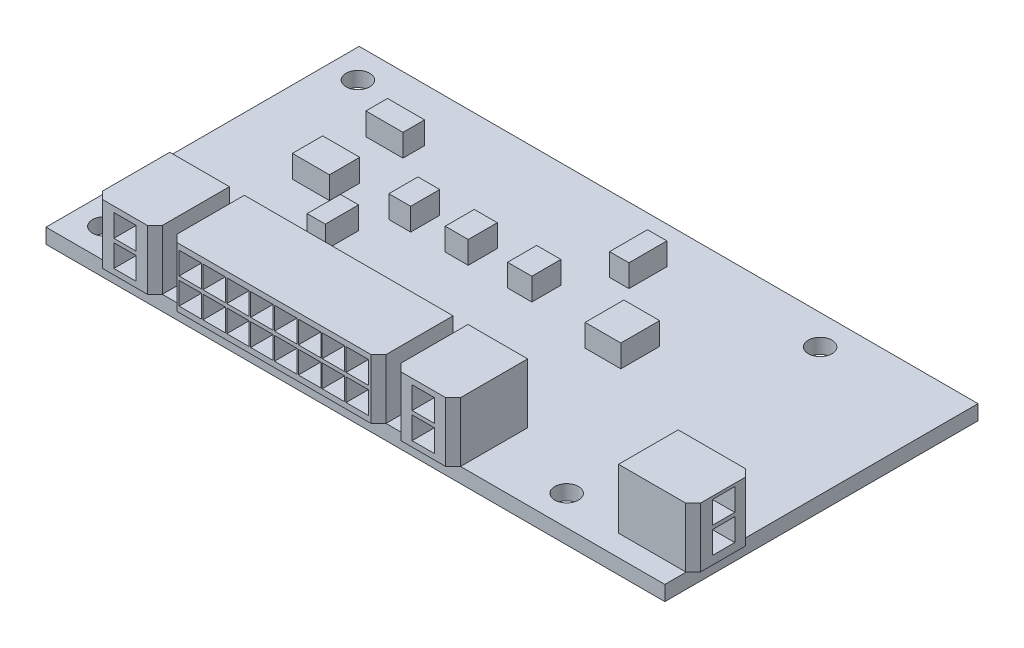
from build123d import *

# Parameters (mm, degrees)
SKETCH1_W           = 83
SKETCH1_H           = 42
BOSS_EXTRUDE1_DEPTH = 2
SKETCH4_R           = 1.5875
CUT_EXTRUDE2_DEPTH  = 94.043000811
BOSS_EXTRUDE2_DEPTH = 8
SKETCH6_W           = 3
SKETCH6_H           = 3
CUT_EXTRUDE3_DEPTH  = 9
SKETCH10_W          = 4.972668361
SKETCH10_H          = 2.900723211
SKETCH10_H_2        = 4.06167287
SKETCH10_W_2        = 4.792773987
SKETCH10_H_3        = 5.198941274
SKETCH10_W_3        = 2.924404467
SKETCH10_H_4        = 3.899205956
SKETCH10_W_4        = 3.086871382
SKETCH10_W_5        = 3.249338296
SKETCH10_W_6        = 2.437003722
SKETCH10_H_5        = 4.467840158
SKETCH10_W_7        = 2.599470637
SKETCH10_H_6        = 5.088357614
BOSS_EXTRUDE6_DEPTH = 3
SKETCH11_W          = 3
SKETCH11_H          = 3
CUT_EXTRUDE4_DEPTH  = 8


with BuildPart() as part:
    # Sketch1 → Boss-Extrude1 (new body)
    with BuildSketch(Plane(origin=(0, 0, 0), x_dir=(1, 0, 0), z_dir=(0, 1, 0))):
        with Locations((41.5, 21)):
            Rectangle(SKETCH1_W, SKETCH1_H)
    extrude(amount=BOSS_EXTRUDE1_DEPTH)

    # Sketch4 → Cut-Extrude2 (cut, through all)
    with BuildSketch(Plane(origin=(0, 2, 0), x_dir=(1, 0, 0), z_dir=(0, 1, 0))):
        with Locations((3.8264, 38)):
            Circle(SKETCH4_R)
        with Locations((65.8264, 4)):
            Circle(SKETCH4_R)
        with Locations((3.8264, 4)):
            Circle(SKETCH4_R)
        with Locations((65.8264, 38)):
            Circle(SKETCH4_R)
    extrude(amount=-CUT_EXTRUDE2_DEPTH, mode=Mode.SUBTRACT)

    # Sketch5 → Boss-Extrude2 (add)
    with BuildSketch(Plane(origin=(0, 2, 0), x_dir=(1, 0, 0), z_dir=(0, 1, 0))):
        Polygon((17.6, 9), (45.6, 9), (45.6, 0), (44.6, -1), (18.6, -1), (17.6, 0), align=None)
        Polygon((7.6, 9), (15.6, 9), (15.6, 0), (14.6, -1), (8.6, -1), (7.6, 0), align=None)
        Polygon((47.6, 9), (55.6, 9), (55.6, 0), (54.6, -1), (48.6, -1), (47.6, 0), align=None)
        Polygon((73.941121903, 2.849151782), (73.941121903, 10.849151782), (82.941121903, 10.849151782), (83.941121903, 9.849151782), (83.941121903, 3.849151782), (82.941121903, 2.849151782), align=None)
    extrude(amount=BOSS_EXTRUDE2_DEPTH)

    # Sketch6 → Cut-Extrude3 (cut)
    with BuildSketch(Plane.XY.offset(1)):
        with Locations((20.35, 4.25)):
            Rectangle(SKETCH6_W, SKETCH6_H)
        with Locations((11.6, 7.75)):
            Rectangle(SKETCH6_W, SKETCH6_H)
        with Locations((23.55, 4.25)):
            Rectangle(SKETCH6_W, SKETCH6_H)
        with Locations((11.6, 4.25)):
            Rectangle(SKETCH6_W, SKETCH6_H)
        with Locations((20.35, 7.75)):
            Rectangle(SKETCH6_W, SKETCH6_H)
        with Locations((51.6, 7.75)):
            Rectangle(SKETCH6_W, SKETCH6_H)
        with Locations((23.55, 7.75)):
            Rectangle(SKETCH6_W, SKETCH6_H)
        with Locations((26.75, 4.25)):
            Rectangle(SKETCH6_W, SKETCH6_H)
        with Locations((26.75, 7.75)):
            Rectangle(SKETCH6_W, SKETCH6_H)
        with Locations((29.95, 4.25)):
            Rectangle(SKETCH6_W, SKETCH6_H)
        with Locations((29.95, 7.75)):
            Rectangle(SKETCH6_W, SKETCH6_H)
        with Locations((33.15, 4.25)):
            Rectangle(SKETCH6_W, SKETCH6_H)
        with Locations((33.15, 7.75)):
            Rectangle(SKETCH6_W, SKETCH6_H)
        with Locations((36.35, 4.25)):
            Rectangle(SKETCH6_W, SKETCH6_H)
        with Locations((36.35, 7.75)):
            Rectangle(SKETCH6_W, SKETCH6_H)
        with Locations((39.55, 4.25)):
            Rectangle(SKETCH6_W, SKETCH6_H)
        with Locations((39.55, 7.75)):
            Rectangle(SKETCH6_W, SKETCH6_H)
        with Locations((42.75, 4.25)):
            Rectangle(SKETCH6_W, SKETCH6_H)
        with Locations((42.75, 7.75)):
            Rectangle(SKETCH6_W, SKETCH6_H)
        with Locations((51.6, 4.25)):
            Rectangle(SKETCH6_W, SKETCH6_H)
    extrude(amount=-CUT_EXTRUDE3_DEPTH, mode=Mode.SUBTRACT)

    # Sketch10 → Boss-Extrude6 (add)
    with BuildSketch(Plane(origin=(0, 2, 0), x_dir=(1, 0, 0), z_dir=(0, 1, 0))):
        with Locations((13.43956041, 33.400988797)):
            Rectangle(SKETCH10_W, SKETCH10_H)
        with Locations((13.43956041, 24.122865076)):
            Rectangle(SKETCH10_W, SKETCH10_H_2)
        with Locations((52.609554771, 24.691499278)):
            Rectangle(SKETCH10_W_2, SKETCH10_H_3)
        with Locations((23.568593744, 25.828767682)):
            Rectangle(SKETCH10_W_3, SKETCH10_H_4)
        with Locations((31.204538742, 25.828767682)):
            Rectangle(SKETCH10_W_4, SKETCH10_H_4)
        with Locations((39.652818313, 25.828767682)):
            Rectangle(SKETCH10_W_5, SKETCH10_H_4)
        with Locations((20.156788533, 18.314672871)):
            Rectangle(SKETCH10_W_6, SKETCH10_H_5)
        with Locations((44.932993045, 34.494805998)):
            Rectangle(SKETCH10_W_7, SKETCH10_H_6)
    extrude(amount=BOSS_EXTRUDE6_DEPTH)

    # Sketch11 → Cut-Extrude4 (cut)
    with BuildSketch(Plane(origin=(83.941121903, 0, 0), x_dir=(0, 0, -1), z_dir=(1, 0, 0))):
        with Locations((6.937992705, 8.119453505)):
            Rectangle(SKETCH11_W, SKETCH11_H)
        with Locations((6.937992705, 4.619453505)):
            Rectangle(SKETCH11_W, SKETCH11_H)
    extrude(amount=-CUT_EXTRUDE4_DEPTH, mode=Mode.SUBTRACT)


solid = part.part
